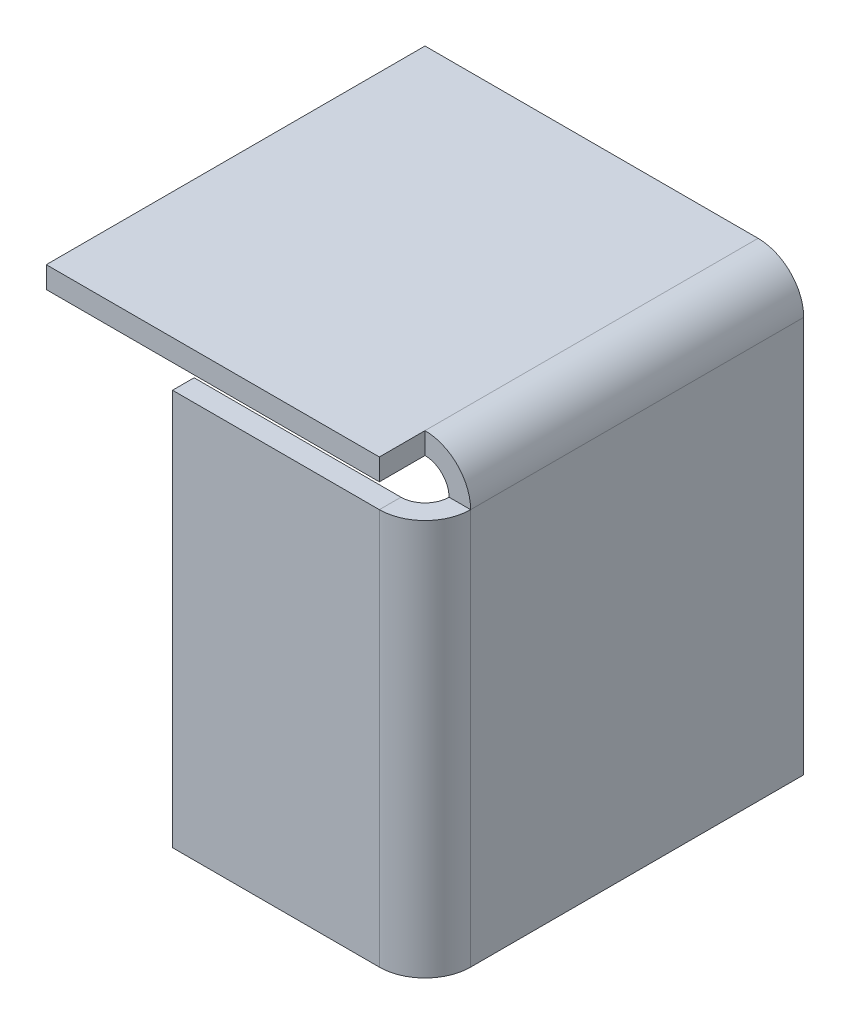
from build123d import *

# Parameters (mm, degrees)
BASE_FLANGE1_DEPTH   = 30
EDGE_FLANGE1_DEPTH   = 35
EDGE_FLANGE1_START   = 31.38558
EDGE_FLANGE1_2_DEPTH = 3.61442
EDGE_FLANGE1_3_DEPTH = 31.38558


# Read off the part's stored shape, not the designer's step: Edge-Flange1
# Sheet-metal steps are written as plain solids
with BuildPart() as part:
    # Sketch1 → Base-Flange1 (new body)
    with BuildSketch(Plane.XY):
        with BuildLine():
            Line((-30, 35), (-3.61442, 35))
            ThreePointArc((-3.61442, 35), (-1.058639108, 33.941360892), (0, 31.38558))
            Line((0, 31.38558), (0, 0))
            Line((0, 0), (-1.70942, 0))
            Line((-1.70942, 0), (-1.70942, 31.38558))
            ThreePointArc((-1.70942, 31.38558), (-2.267381582, 32.732618418), (-3.61442, 33.29058))
            Line((-3.61442, 33.29058), (-30, 33.29058))
            Line((-30, 33.29058), (-30, 35))
        make_face()
    extrude(amount=BASE_FLANGE1_DEPTH)

    # Edge-Flange1 outline → Edge-Flange1 (cut)
    with BuildSketch(Plane(origin=(0, 0, 0), x_dir=(1, 0, 0), z_dir=(0, 1, 0))):
        with BuildLine():
            Line((-3.61442, -30), (0, -30))
            Line((0, -30), (0, -26.38558))
            ThreePointArc((0, -26.38558), (-1.058639108, -28.941360892), (-3.61442, -30))
        make_face()
        with BuildLine():
            Line((-3.61442, -26.38558), (-3.61442, -28.29058))
            ThreePointArc((-3.61442, -28.29058), (-2.267381582, -27.732618418), (-1.70942, -26.38558))
            Line((-1.70942, -26.38558), (-3.61442, -26.38558))
        make_face()
    extrude(amount=EDGE_FLANGE1_DEPTH, mode=Mode.SUBTRACT)

    # Edge-Flange1 2 outline → Edge-Flange1 2 (cut)
    with BuildSketch(Plane(origin=(0, 0, 0), x_dir=(1, 0, 0), z_dir=(0, 1, 0)).offset(EDGE_FLANGE1_START)):
        with BuildLine():
            Line((-3.61442, -28.29058), (-3.61442, -30))
            ThreePointArc((-3.61442, -30), (-1.058639108, -28.941360892), (0, -26.38558))
            Line((0, -26.38558), (-1.70942, -26.38558))
            ThreePointArc((-1.70942, -26.38558), (-2.267381582, -27.732618418), (-3.61442, -28.29058))
        make_face()
    extrude(amount=EDGE_FLANGE1_2_DEPTH, mode=Mode.SUBTRACT)

    # Edge-Flange1 3 outline → Edge-Flange1 3 (add)
    with BuildSketch(Plane(origin=(0, 0, 0), x_dir=(1, 0, 0), z_dir=(0, 1, 0))):
        with BuildLine():
            Line((-20, -30), (-3.61442, -30))
            ThreePointArc((-3.61442, -30), (-2.624012381, -29.861658924), (-1.70942, -29.45722564))
            Line((-1.70942, -29.45722564), (-1.70942, -26.38558))
            ThreePointArc((-1.70942, -26.38558), (-2.267381582, -27.732618418), (-3.61442, -28.29058))
            Line((-3.61442, -28.29058), (-20, -28.29058))
            Line((-20, -28.29058), (-20, -30))
        make_face()
    extrude(amount=EDGE_FLANGE1_3_DEPTH)


solid = part.part
